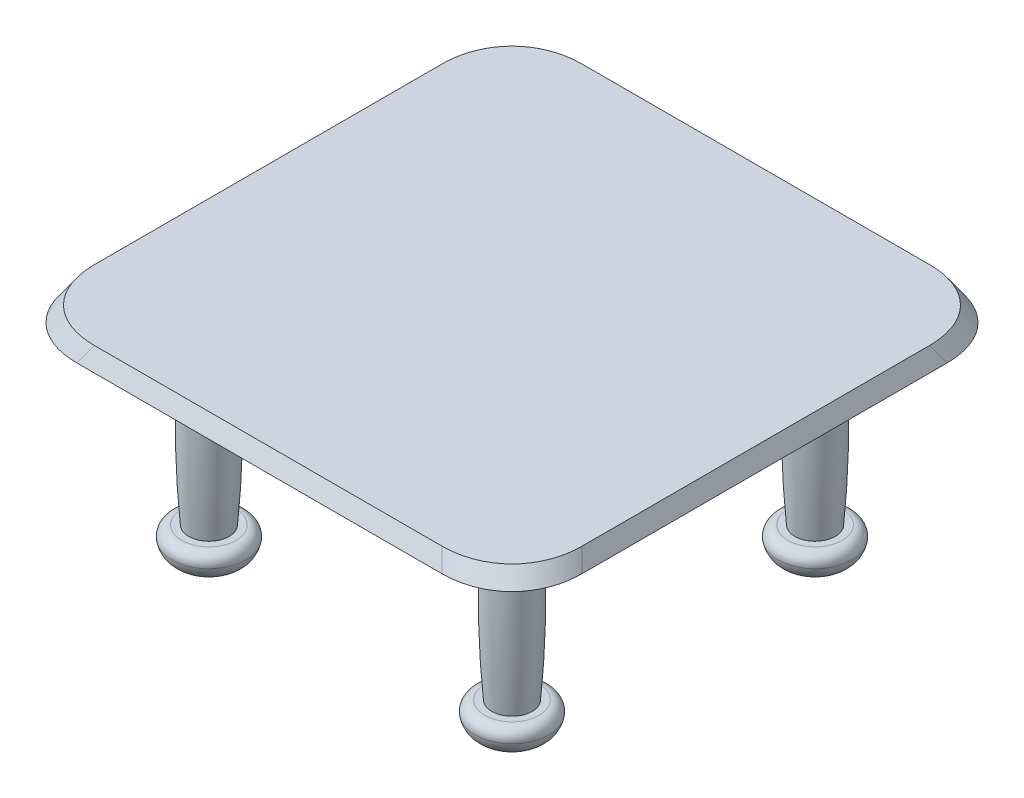
from build123d import *

# Parameters (mm, degrees)
FILLET1_R           = 10
LPATTERN2_COUNT     = 2
LPATTERN2_PITCH     = 300
LPATTERN3_COUNT     = 2
LPATTERN3_PITCH     = 300
SKETCH2_W           = 500
SKETCH2_H           = 500
BOSS_EXTRUDE1_DEPTH = 15
BOSS_EXTRUDE1_TAPER = 30
FILLET2_R           = 80


with BuildPart() as part:
    # Sketch1 → Revolve1 (revolve)
    with BuildSketch(Plane.XY, mode=Mode.PRIVATE) as revolve1_sk:
        with BuildLine():
            Line((0, 200), (0, 0))
            Line((0, 0), (25, 0))
            ThreePointArc((25, 0), (35.658376663, 11.181839274), (35.288232701, 26.625204065))
            Line((35.288232701, 26.625204065), (20, 26.625204065))
            ThreePointArc((20, 26.625204065), (23.557403108, 113.312602033), (20, 200))
            Line((20, 200), (0, 200))
        make_face()
    revolve(revolve1_sk.sketch.rotate(Axis((0, 200, 0), (0, -1, 0)), 180), axis=Axis((0, 200, 0), (0, -1, 0)))

    # Fillet1
    fillet1_edges = [part.edges().sort_by_distance(p)[0] for p in [
        (35.288232701, 26.625204065, 0),
    ]]
    fillet(fillet1_edges, radius=FILLET1_R)


with BuildPart() as lpattern2_1:
    # LPattern2: pattern copy
    add(part.part.moved(Location(Vector(0, 0, -1) * (1 * LPATTERN2_PITCH))))


with BuildPart() as lpattern3_1:
    # LPattern3: pattern copy
    add(lpattern2_1.part.moved(Location(Vector(-1, 0, 0) * (1 * LPATTERN3_PITCH))))


with BuildPart() as lpattern3_2:
    # LPattern3: pattern copy
    add(part.part.moved(Location(Vector(-1, 0, 0) * (1 * LPATTERN3_PITCH))))


with BuildPart() as part_1:
    add(part.part)

    add(lpattern2_1.part)  # Boss-Extrude1 merges LPattern2_1

    add(lpattern3_1.part)  # Boss-Extrude1 merges LPattern3_1

    add(lpattern3_2.part)  # Boss-Extrude1 merges LPattern3_2
    # Sketch2 → Boss-Extrude1 (add)
    with BuildSketch(Plane(origin=(0, 200, 0), x_dir=(1, 0, 0), z_dir=(0, 1, 0))):
        with Locations((-150, 150)):
            Rectangle(SKETCH2_W, SKETCH2_H)
    extrude(amount=BOSS_EXTRUDE1_DEPTH, taper=BOSS_EXTRUDE1_TAPER)

    # Fillet2
    # the kernel refuses this fillet: 80 mm, written as the material it takes off along each edge
    with BuildSketch(Plane(origin=(-469.282032303, 80, -469.282032303), x_dir=(-0.22360679774997919, -0.3872983346207402, 0.8944271909999165), z_dir=(0.44721359549995965, 0.774596669241483, 0.4472135954999567)), Plane(origin=(169.282032303, 80, -469.282032303), x_dir=(-0.8944271909999159, -0.38729833462074126, -0.22360679774997977), z_dir=(-0.4472135954999579, 0.7745966692414825, 0.4472135954999594))) as fillet2_piece_1:
        with BuildLine():
            CenterArc((FILLET2_R * 0.774596669241, FILLET2_R), FILLET2_R, 194.477512186, 75.522487814)
            Line((-FILLET2_R * 0.19364916731, FILLET2_R * 0.75), (0, 0))
            Line((0, 0), (FILLET2_R * 0.774596669241, 0))
        make_face()
    extrude(amount=329.203584428, mode=Mode.SUBTRACT)
    with BuildSketch(Plane(origin=(-469.282032303, 80, 169.282032303), x_dir=(-0.22360679774998043, -0.38729833462074226, -0.8944271909999153), z_dir=(0.4472135954999591, 0.774596669241482, -0.4472135954999591)), Plane(origin=(169.282032303, 80, 169.282032303), x_dir=(-0.8944271909999149, -0.387298334620743, 0.22360679774998055), z_dir=(-0.4472135954999599, 0.774596669241482, -0.4472135954999584))) as fillet2_piece_2:
        with BuildLine():
            CenterArc((FILLET2_R * 0.774596669241, -FILLET2_R), FILLET2_R, 90, 75.522487814)
            Line((-FILLET2_R * 0.19364916731, -FILLET2_R * 0.75), (0, 0))
            Line((0, 0), (FILLET2_R * 0.774596669241, 0))
        make_face()
    extrude(amount=329.203584428, mode=Mode.SUBTRACT)


solid = part_1.part
